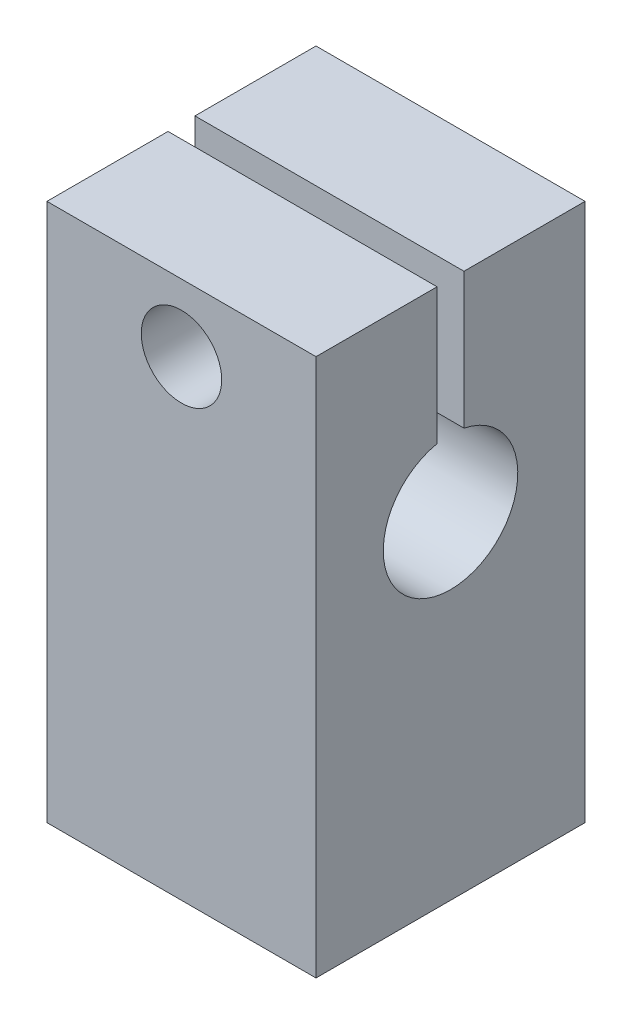
from build123d import *

# Parameters (mm, degrees)
SKETCH1_W                      = 12.7
SKETCH1_H                      = 12.7
BOSS_EXTRUDE1_DEPTH            = 25.4
F_1_4_0_25_DIAMETER_HOLE1_D    = 6.35
SKETCH4_W                      = 1.27
SKETCH4_H                      = 7.62
CUT_EXTRUDE1_DEPTH             = 32.108519733
TAP_DRILL_FOR_10_32_TAP1_DEPTH = 18.986851973
F_6_CLEARANCE_HOLE1_D          = 3.7973
F_6_CLEARANCE_HOLE1_DEPTH      = 5.715
TAP_DRILL_FOR_6_32_TAP1_D      = 2.7051


# Read off the part's stored shape, not the designer's step: Tap Drill for #10-32 Tap1
with BuildPart() as part:
    # Sketch1 → Boss-Extrude1 (new body)
    with BuildSketch(Plane(origin=(0, 0, 0), x_dir=(1, 0, 0), z_dir=(0, 1, 0))):
        with Locations((6.35, 6.35)):
            Rectangle(SKETCH1_W, SKETCH1_H)
    extrude(amount=BOSS_EXTRUDE1_DEPTH)

    # 1/4 (0.25) Diameter Hole1 (through all)
    with Locations(Plane(origin=(12.7, 0, 0), x_dir=(0, 0, -1), z_dir=(1, 0, 0))):
        with Locations((6.35, 15.875)):
            Hole(F_1_4_0_25_DIAMETER_HOLE1_D / 2)

    # Sketch4 → Cut-Extrude1 (cut, through all)
    with BuildSketch(Plane(origin=(12.7, 0, 0), x_dir=(0, 0, -1), z_dir=(1, 0, 0))):
        with Locations((6.35, 21.59)):
            Rectangle(SKETCH4_W, SKETCH4_H)
    extrude(amount=-CUT_EXTRUDE1_DEPTH, mode=Mode.SUBTRACT)

    # Tap Drill for #10-32 Tap1 outline → Tap Drill for #10-32 Tap1 (cut)
    with BuildSketch(Plane(origin=(0, 0, 0), x_dir=(1, 0, 0), z_dir=(0, 1, 0))):
        with BuildLine():
            ThreePointArc((8.266858756, 5.715), (8.3693, 6.35), (8.266858756, 6.985))
            ThreePointArc((8.266858756, 6.985), (6.35, 8.3693), (4.433141244, 6.985))
            ThreePointArc((4.433141244, 6.985), (4.3307, 6.35), (4.433141244, 5.715))
            ThreePointArc((4.433141244, 5.715), (6.35, 4.3307), (8.266858756, 5.715))
        make_face()
    extrude(amount=TAP_DRILL_FOR_10_32_TAP1_DEPTH, mode=Mode.SUBTRACT)

    # #6 Clearance Hole1
    with Locations(Plane.XY):
        with Locations((6.35, 22.225)):
            Hole(F_6_CLEARANCE_HOLE1_D / 2, depth=F_6_CLEARANCE_HOLE1_DEPTH)

    # Tap Drill for #6-32 Tap1 (through all)
    with Locations(Plane.XY.offset(-6.985)):
        with Locations((6.35, 22.225)):
            Hole(TAP_DRILL_FOR_6_32_TAP1_D / 2)


solid = part.part
